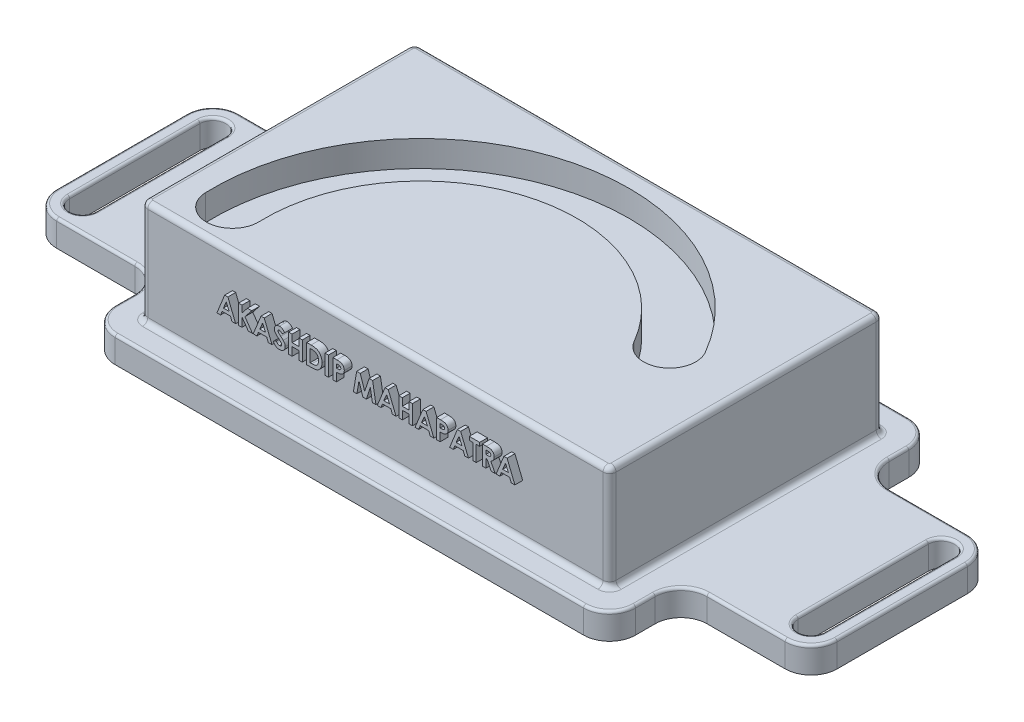
from build123d import *

# Parameters (mm, degrees)
SKETCH1_W           = 50
SKETCH1_H           = 70
BOSS_EXTRUDE1_DEPTH = 10
FILLET1_R           = 10
BOSS_EXTRUDE2_DEPTH = 40
FILLET2_R           = 2
CUT_EXTRUDE1_DEPTH  = 10
FILLET3_R           = 1
WRAP1_OUTLINE_W     = 1.329700854
WRAP1_OUTLINE_H     = 7.408333333
WRAP1_DEPTH         = 3


# Read off the part's stored shape, not the designer's step: Wrap1
with BuildPart() as part:
    # Sketch1 → Boss-Extrude1 (new body)
    # profile 1 of 5: a face of its own
    with BuildSketch(Plane(origin=(0, 0, 0), x_dir=(1, 0, 0), z_dir=(0, 1, 0))):
        with BuildLine():
            Line((140, 35), (100, 35))
            Line((100, 35), (100, -35))
            Line((100, -35), (140, -35))
            ThreePointArc((140, -35), (147.071067812, -32.071067812), (150, -25))
            Line((150, -25), (150, 25))
            ThreePointArc((150, 25), (147.071067812, 32.071067812), (140, 35))
        make_face()
        with BuildLine():
            Line((135, -25), (135, 25))
            ThreePointArc((135, 25), (140, 30), (145, 25))
            Line((145, 25), (145, -25))
            ThreePointArc((145, -25), (140, -30), (135, -25))
        make_face(mode=Mode.SUBTRACT)
    # profile 2 of 5: a face of its own
    with BuildSketch(Plane(origin=(0, 0, 0), x_dir=(1, 0, 0), z_dir=(0, 1, 0))):
        with Locations((75, 0)):
            Rectangle(SKETCH1_W, SKETCH1_H)
    # profile 3 of 5: a face of its own
    with BuildSketch(Plane(origin=(0, 0, 0), x_dir=(1, 0, 0), z_dir=(0, 1, 0))):
        with BuildLine():
            Line((90, 62.5), (-90, 62.5))
            ThreePointArc((-90, 62.5), (-97.071067812, 59.571067812), (-100, 52.5))
            Line((-100, 52.5), (-100, 35))
            Line((-100, 35), (-50, 35))
            Line((-50, 35), (-50, -35))
            Line((-50, -35), (-100, -35))
            Line((-100, -35), (-100, -52.5))
            ThreePointArc((-100, -52.5), (-97.071067812, -59.571067812), (-90, -62.5))
            Line((-90, -62.5), (90, -62.5))
            ThreePointArc((90, -62.5), (97.071067812, -59.571067812), (100, -52.5))
            Line((100, -52.5), (100, -35))
            Line((100, -35), (50, -35))
            Line((50, -35), (50, 35))
            Line((50, 35), (100, 35))
            Line((100, 35), (100, 52.5))
            ThreePointArc((100, 52.5), (97.071067812, 59.571067812), (90, 62.5))
        make_face()
    # profile 4 of 5: a face of its own
    with BuildSketch(Plane(origin=(0, 0, 0), x_dir=(1, 0, 0), z_dir=(0, 1, 0))):
        with Locations((-75, 0)):
            Rectangle(SKETCH1_W, SKETCH1_H)
    # profile 5 of 5: a face of its own
    with BuildSketch(Plane(origin=(0, 0, 0), x_dir=(1, 0, 0), z_dir=(0, 1, 0))):
        with BuildLine():
            Line((-100, -35), (-100, 35))
            Line((-100, 35), (-140, 35))
            ThreePointArc((-140, 35), (-147.071067812, 32.071067812), (-150, 25))
            Line((-150, 25), (-150, -25))
            ThreePointArc((-150, -25), (-147.071067812, -32.071067812), (-140, -35))
            Line((-140, -35), (-100, -35))
        make_face()
        with BuildLine():
            ThreePointArc((-145, 25), (-140, 30), (-135, 25))
            Line((-135, 25), (-135, -25))
            ThreePointArc((-135, -25), (-140, -30), (-145, -25))
            Line((-145, -25), (-145, 25))
        make_face(mode=Mode.SUBTRACT)
    extrude(amount=BOSS_EXTRUDE1_DEPTH)

    # Fillet1
    fillet1_edges = [part.edges().sort_by_distance(p)[0] for p in [
        (100, 5, -35),
        (100, 5, 35),
        (-100, 5, 35),
        (-100, 5, -35),
    ]]
    fillet(fillet1_edges, radius=FILLET1_R)

    # Sketch2 → Boss-Extrude2 (add)
    with BuildSketch(Plane(origin=(0, 10, 0), x_dir=(1, 0, 0), z_dir=(0, 1, 0))):
        with BuildLine():
            Line((-87.5, 52.5), (87.5, 52.5))
            ThreePointArc((87.5, 52.5), (89.267766953, 51.767766953), (90, 50))
            Line((90, 50), (90, -50))
            ThreePointArc((90, -50), (89.267766953, -51.767766953), (87.5, -52.5))
            Line((87.5, -52.5), (-87.5, -52.5))
            ThreePointArc((-87.5, -52.5), (-89.267766953, -51.767766953), (-90, -50))
            Line((-90, -50), (-90, 50))
            ThreePointArc((-90, 50), (-89.267766953, 51.767766953), (-87.5, 52.5))
        make_face()
    extrude(amount=BOSS_EXTRUDE2_DEPTH)

    # Fillet2
    fillet2_edges = [part.edges().sort_by_distance(p)[0] for p in [
        (89.267766953, 10, -51.767766953),
        (0, 10, -52.5),
        (-89.267766953, 10, -51.767766953),
        (-90, 10, 0),
        (-89.267766953, 10, 51.767766953),
        (0, 10, 52.5),
        (89.267766953, 10, 51.767766953),
        (90, 10, 0),
        (89.267766953, 50, -51.767766953),
        (0, 50, -52.5),
        (-89.267766953, 50, -51.767766953),
        (-90, 50, 0),
        (-89.267766953, 50, 51.767766953),
        (0, 50, 52.5),
        (89.267766953, 50, 51.767766953),
        (90, 50, 0),
    ]]
    fillet(fillet2_edges, radius=FILLET2_R)

    # Sketch3 → Cut-Extrude1 (cut)
    with BuildSketch(Plane(origin=(0, 50, 0), x_dir=(1, 0, 0), z_dir=(0, 1, 0))):
        with BuildLine():
            ThreePointArc((69.282032303, 5), (-22.082335197, 41.891940229), (-79.948963312, -37.857142857))
            ThreePointArc((-79.948963312, -37.857142857), (-69.598200041, -47.493620414), (-59.961722484, -37.142857143))
            ThreePointArc((-59.961722484, -37.142857143), (-16.561751398, 22.668955172), (51.961524227, -5))
            ThreePointArc((51.961524227, -5), (65.621778265, -8.660254038), (69.282032303, 5))
        make_face()
    extrude(amount=-CUT_EXTRUDE1_DEPTH, mode=Mode.SUBTRACT)

    # Fillet3
    fillet3_edges = [part.edges().sort_by_distance(p)[0] for p in [
        (145, 10, 0),
        (140, 10, 30),
        (135, 10, 0),
        (140, 10, -30),
        (-140, 10, 30),
        (-145, 10, 0),
        (-140, 10, -30),
        (-135, 10, 0),
        (-147.071067812, 10, -32.071067812),
        (-150, 10, 0),
        (-147.071067812, 10, 32.071067812),
        (-97.071067812, 10, 59.571067812),
        (0, 10, 62.5),
        (97.071067812, 10, 59.571067812),
        (147.071067812, 10, 32.071067812),
        (-100, 10, -48.75),
        (150, 10, 0),
        (147.071067812, 10, -32.071067812),
        (-125, 10, -35),
        (100, 10, -48.75),
        (-100, 10, 48.75),
        (-125, 10, 35),
        (97.071067812, 10, -59.571067812),
        (125, 10, -35),
        (125, 10, 35),
        (100, 10, 48.75),
        (-102.928932188, 10, -37.928932188),
        (0, 10, -62.5),
        (-102.928932188, 10, 37.928932188),
        (102.928932188, 10, -37.928932188),
        (102.928932188, 10, 37.928932188),
        (-97.071067812, 10, -59.571067812),
    ]]
    fillet(fillet3_edges, radius=FILLET3_R)

    # Wrap1 outline → Wrap1 (add)
    # profile 1 of 17: a face of its own
    with BuildSketch(Plane.XY.offset(52.5)):
        with BuildLine():
            add(Edge.make_bspline(
                [(-32.85559952, 35.308802516), (-32.898191392, 35.36888278), (-32.979961848, 35.484228508), (-33.112503227, 35.638679156), (-33.244446113, 35.770437053), (-33.377012878, 35.878951776), (-33.511378543, 35.963564016), (-33.647309868, 36.023470416), (-33.784036222, 36.061553483), (-33.875895225, 36.066295741), (-33.921141053, 36.068631576)],
                knots=[0, 0, 0, 0, 0.162420307, 0.31182434, 0.448432767, 0.573381197, 0.689077147, 0.797572901, 0.900293043, 1, 1, 1, 1], degree=3))
            Line((-32.85559952, 35.308802516), (-31.861291961, 36.21851973))
            add(Edge.make_bspline(
                [(-33.906300642, 37.39833243), (-33.81901379, 37.395139291), (-33.645129099, 37.388778219), (-33.388035568, 37.339036711), (-33.136917356, 37.26081295), (-32.934561594, 37.166444588), (-32.773550892, 37.075029912), (-32.650151229, 36.990866793), (-32.52458543, 36.894453417), (-32.395840884, 36.785485959), (-32.266309865, 36.66191133), (-32.132309186, 36.526671322), (-31.99566477, 36.378597143), (-31.906867565, 36.272813637), (-31.861291961, 36.21851973)],
                knots=[0, 0, 0, 0, 0.10691022, 0.212976528, 0.319776676, 0.428556273, 0.485856803, 0.546558687, 0.611431498, 0.67982091, 0.753158505, 0.830752869, 0.913133075, 1, 1, 1, 1], degree=3))
            add(Edge.make_bspline(
                [(-35.850394525, 35.519536357), (-35.848787564, 35.582962532), (-35.845621677, 35.707918912), (-35.817381475, 35.891649061), (-35.775175419, 36.068933217), (-35.713880108, 36.239124567), (-35.634326195, 36.402009939), (-35.537711058, 36.558386726), (-35.422534447, 36.706815671), (-35.292738182, 36.847198377), (-35.14973593, 36.975492194), (-34.99691985, 37.088724343), (-34.835154895, 37.184361862), (-34.665430662, 37.263700129), (-34.48669544, 37.324428532), (-34.300265962, 37.367475851), (-34.105874831, 37.393079024), (-33.97365418, 37.396559478), (-33.906300642, 37.39833243)],
                knots=[0, 0, 0, 0, 0.06317288, 0.12445736, 0.184840915, 0.244566821, 0.304319173, 0.365199786, 0.427420983, 0.491261689, 0.555499002, 0.618604518, 0.680494764, 0.742473305, 0.804990665, 0.868251971, 0.932887217, 1, 1, 1, 1], degree=3))
            add(Edge.make_bspline(
                [(-33.983470781, 32.919496292), (-34.077766347, 32.999279384), (-34.25874808, 33.152407284), (-34.514498229, 33.378572373), (-34.744952014, 33.589944372), (-34.948118987, 33.7891363), (-35.12658781, 33.972469546), (-35.279149814, 34.14143321), (-35.404129037, 34.297330618), (-35.53564272, 34.481980665), (-35.660607013, 34.706989435), (-35.768611624, 34.97770107), (-35.838680457, 35.248378355), (-35.846530696, 35.430096176), (-35.850394525, 35.519536357)],
                knots=[0, 0, 0, 0, 0.112124581, 0.215201009, 0.309902452, 0.395959096, 0.473447494, 0.542140328, 0.602523333, 0.654726333, 0.747804055, 0.835278417, 0.918925243, 1, 1, 1, 1], degree=3))
            add(Edge.make_bspline(
                [(-33.001035551, 31.641736877), (-33.003474883, 31.684010443), (-33.008430152, 31.769885145), (-33.044929139, 31.897567017), (-33.101988188, 32.025190823), (-33.169493067, 32.129871321), (-33.238187734, 32.217517464), (-33.30387533, 32.293458882), (-33.383865445, 32.377360855), (-33.47795526, 32.469328924), (-33.584901602, 32.570172707), (-33.704794561, 32.67988233), (-33.839007038, 32.797491382), (-33.933868681, 32.877605506), (-33.983470781, 32.919496292)],
                knots=[0, 0, 0, 0, 0.076346606, 0.155090822, 0.238351561, 0.32840414, 0.37938386, 0.439617644, 0.509831416, 0.588874645, 0.677436354, 0.77554672, 0.882635872, 1, 1, 1, 1], degree=3))
            add(Edge.make_bspline(
                [(-33.846938996, 30.939785422), (-33.78928309, 30.942117175), (-33.677422234, 30.946641115), (-33.517755177, 30.98842739), (-33.371366373, 31.054034907), (-33.244828973, 31.147647786), (-33.13768508, 31.255691277), (-33.058606737, 31.375894601), (-33.008929188, 31.505951696), (-33.003677067, 31.596297909), (-33.001035551, 31.641736877)],
                knots=[0, 0, 0, 0, 0.141985893, 0.275473311, 0.404345843, 0.535429711, 0.661427401, 0.77786684, 0.888279749, 1, 1, 1, 1], degree=3))
            add(Edge.make_bspline(
                [(-35.060884643, 31.889571747), (-35.01770716, 31.814518951), (-34.934932236, 31.670636327), (-34.794662389, 31.477311785), (-34.650963091, 31.311761316), (-34.500512144, 31.176911036), (-34.345138975, 31.070957821), (-34.184093096, 30.995236304), (-34.017261358, 30.94836477), (-33.903623157, 30.942640673), (-33.846938996, 30.939785422)],
                knots=[0, 0, 0, 0, 0.160457921, 0.307611547, 0.442138888, 0.566229194, 0.681222208, 0.789558005, 0.895028892, 1, 1, 1, 1], degree=3))
            Line((-35.060884643, 31.889571747), (-36.230309055, 31.187620291))
            add(Edge.make_bspline(
                [(-33.895912354, 29.610084567), (-33.959273199, 29.611208631), (-34.084764011, 29.613434921), (-34.269718496, 29.631610731), (-34.448312959, 29.660944554), (-34.620346229, 29.702988685), (-34.786593347, 29.756264302), (-34.947061141, 29.821338426), (-35.100641847, 29.899219684), (-35.248497531, 29.988306526), (-35.389909431, 30.091748084), (-35.526665644, 30.20742953), (-35.65740778, 30.337130096), (-35.782763765, 30.480543045), (-35.901931537, 30.638074488), (-36.018811884, 30.807530508), (-36.128210293, 30.99205598), (-36.195790557, 31.121502091), (-36.230309055, 31.187620291)],
                knots=[0, 0, 0, 0, 0.063551482, 0.125868382, 0.18624025, 0.244976651, 0.303357688, 0.361230317, 0.418489049, 0.475936712, 0.534203744, 0.594059429, 0.655468694, 0.718771685, 0.784974607, 0.853522316, 0.925182451, 1, 1, 1, 1], degree=3))
            add(Edge.make_bspline(
                [(-31.671334696, 31.718907016), (-31.672660799, 31.644086191), (-31.675262662, 31.497284947), (-31.707130492, 31.282463193), (-31.752572147, 31.076869451), (-31.822832917, 30.882740872), (-31.908466328, 30.696890894), (-32.015820176, 30.522214469), (-32.141892551, 30.3569438), (-32.28639085, 30.204033302), (-32.446223127, 30.065277624), (-32.617658434, 29.941754041), (-32.802373152, 29.839769591), (-32.998789108, 29.75579267), (-33.206801164, 29.691112522), (-33.426161516, 29.643307865), (-33.65720569, 29.614616264), (-33.815197025, 29.611616897), (-33.895912354, 29.610084567)],
                knots=[0, 0, 0, 0, 0.065200875, 0.127926544, 0.18904691, 0.248543693, 0.307607127, 0.36724766, 0.426963056, 0.488617128, 0.550391855, 0.611330734, 0.672556085, 0.734024191, 0.797340621, 0.862249627, 0.929625466, 1, 1, 1, 1], degree=3))
            add(Edge.make_bspline(
                [(-32.437099921, 33.418134113), (-32.3716958, 33.347352847), (-32.245966112, 33.211286397), (-32.082561839, 33.000426191), (-31.948074838, 32.794583635), (-31.844033143, 32.589885467), (-31.76545667, 32.383378299), (-31.710059216, 32.169997556), (-31.676881312, 31.947513542), (-31.67319779, 31.795695362), (-31.671334696, 31.718907016)],
                knots=[0, 0, 0, 0, 0.150833097, 0.289954183, 0.417138648, 0.535255184, 0.648751095, 0.762405462, 0.879826701, 1, 1, 1, 1], degree=3))
            add(Edge.make_bspline(
                [(-33.391338369, 34.272941805), (-33.329020209, 34.219008581), (-33.210753288, 34.116654526), (-33.042482945, 33.97137938), (-32.894601339, 33.840678873), (-32.764954172, 33.72651454), (-32.655506768, 33.627688536), (-32.565799011, 33.543728475), (-32.494735272, 33.476268904), (-32.454339698, 33.435523281), (-32.437099921, 33.418134113)],
                knots=[0, 0, 0, 0, 0.192952702, 0.366184141, 0.520457298, 0.655012135, 0.770624226, 0.865677185, 0.942674527, 1, 1, 1, 1], degree=3))
            add(Edge.make_bspline(
                [(-34.397518257, 35.228664295), (-34.380480757, 35.207155254), (-34.341262682, 35.157644282), (-34.266481845, 35.07922662), (-34.172572819, 34.983158121), (-34.055921788, 34.872742297), (-33.921371255, 34.744008166), (-33.762684631, 34.602016313), (-33.584429609, 34.442369417), (-33.457730068, 34.3311971), (-33.391338369, 34.272941805)],
                knots=[0, 0, 0, 0, 0.059234189, 0.136349281, 0.233805212, 0.349411224, 0.48317915, 0.635966856, 0.809243356, 1, 1, 1, 1], degree=3))
            add(Edge.make_bspline(
                [(-34.520693671, 35.583350125), (-34.519384942, 35.552514552), (-34.516749344, 35.490415991), (-34.491293053, 35.399402818), (-34.452923155, 35.310472353), (-34.416259151, 35.256336147), (-34.397518257, 35.228664295)],
                knots=[0, 0, 0, 0, 0.241881375, 0.487115475, 0.73783784, 1, 1, 1, 1], degree=3))
            add(Edge.make_bspline(
                [(-33.921141053, 36.068631576), (-33.963345064, 36.067151484), (-34.04482992, 36.064293816), (-34.160992627, 36.035888808), (-34.264123533, 35.986865935), (-34.354121986, 35.922764405), (-34.425414039, 35.845536922), (-34.482335215, 35.764545149), (-34.51438662, 35.675148549), (-34.518605216, 35.613747357), (-34.520693671, 35.583350125)],
                knots=[0, 0, 0, 0, 0.148126258, 0.285992887, 0.416634394, 0.547379946, 0.671582838, 0.784400739, 0.893265576, 1, 1, 1, 1], degree=3))
        make_face()
    # profile 2 of 17: a face of its own
    with BuildSketch(Plane.XY.offset(52.5)):
        with BuildLine():
            add(Edge.make_bspline(
                [(-21.732711232, 37.208375165), (-21.602088105, 37.207462065), (-21.349592122, 37.205697032), (-20.983775396, 37.185809351), (-20.643612392, 37.155223509), (-20.328883833, 37.113147141), (-20.040234965, 37.057468584), (-19.778037995, 36.987630747), (-19.541412926, 36.907014582), (-19.327765213, 36.812153306), (-19.132725401, 36.701554479), (-18.947528875, 36.578356265), (-18.772539263, 36.438045553), (-18.605300864, 36.283329217), (-18.447971924, 36.111376768), (-18.297932353, 35.925036364), (-18.158855801, 35.721605809), (-18.026538283, 35.505962728), (-17.906874696, 35.277193245), (-17.802499643, 35.0372446), (-17.715064029, 34.78766095), (-17.644018064, 34.528176305), (-17.587386231, 34.259652075), (-17.547762079, 33.981546402), (-17.523266033, 33.694116767), (-17.520781114, 33.499311591), (-17.519518457, 33.400325619)],
                knots=[0, 0, 0, 0, 0.060148162, 0.116267077, 0.168653955, 0.217398969, 0.262433523, 0.303932701, 0.342259967, 0.377441339, 0.411406099, 0.445398351, 0.479766387, 0.514584482, 0.550213651, 0.587000908, 0.624662987, 0.663615456, 0.703456428, 0.743450162, 0.784013386, 0.825132536, 0.867264663, 0.910306473, 0.954424205, 1, 1, 1, 1], degree=3))
            Line((-21.732711232, 37.208375165), (-23.408193671, 37.208375165))
            Line((-23.408193671, 37.208375165), (-23.408193671, 29.800041832))
            Line((-23.408193671, 29.800041832), (-21.707482533, 29.800041832))
            add(Edge.make_bspline(
                [(-17.519518457, 33.400325619), (-17.522824775, 33.260649971), (-17.529333455, 32.98569028), (-17.584158939, 32.582190102), (-17.672830311, 32.195394936), (-17.797510313, 31.828330446), (-17.95208014, 31.484265393), (-18.136731107, 31.169267222), (-18.348755801, 30.885026682), (-18.585684121, 30.632959058), (-18.842219788, 30.41630352), (-19.108812077, 30.230753906), (-19.388058082, 30.084432552), (-19.634112838, 29.991642933), (-19.847473009, 29.933935818), (-20.03480093, 29.899830357), (-20.247586336, 29.868553593), (-20.487813264, 29.844383582), (-20.754427891, 29.822829872), (-21.048492947, 29.811118425), (-21.369056333, 29.801387951), (-21.591717914, 29.800502296), (-21.707482533, 29.800041832)],
                knots=[0, 0, 0, 0, 0.065772947, 0.129477895, 0.191430088, 0.252445668, 0.311786958, 0.36881755, 0.424091518, 0.478492106, 0.531393744, 0.58200397, 0.631201271, 0.679503008, 0.705561374, 0.735221723, 0.769132486, 0.80685832, 0.848929771, 0.895116661, 0.945469804, 1, 1, 1, 1], degree=3))
        make_face()
        with BuildLine():
            add(Edge.make_bspline(
                [(-21.383961566, 31.129742687), (-21.301323014, 31.129894115), (-21.142381567, 31.130185361), (-20.912906096, 31.144057685), (-20.70069947, 31.157981673), (-20.506345845, 31.184409867), (-20.328430776, 31.213849016), (-20.16939835, 31.254817622), (-20.025970217, 31.297851672), (-19.899898324, 31.352639352), (-19.784426742, 31.414306532), (-19.677513247, 31.486556782), (-19.574311791, 31.566787961), (-19.476751808, 31.65735978), (-19.384464058, 31.757072899), (-19.297994572, 31.866441096), (-19.216189213, 31.985130684), (-19.141147768, 32.113769205), (-19.072574495, 32.250998208), (-19.011742317, 32.395488428), (-18.961303465, 32.54844316), (-18.919381779, 32.708430561), (-18.889423981, 32.876843505), (-18.864639618, 33.05243458), (-18.851862556, 33.235899463), (-18.850108984, 33.360735101), (-18.849219312, 33.424070278)],
                knots=[0, 0, 0, 0, 0.062614648, 0.120428813, 0.174199486, 0.223724664, 0.26902845, 0.310765001, 0.348115258, 0.382378114, 0.414753161, 0.447195432, 0.480044579, 0.513738641, 0.547962504, 0.582917814, 0.619315101, 0.657123545, 0.695686576, 0.735513716, 0.7758232, 0.817652262, 0.860742584, 0.905386927, 0.951998197, 1, 1, 1, 1], degree=3))
            Line((-21.383961566, 31.129742687), (-22.078492816, 31.129742687))
            Line((-22.078492816, 31.129742687), (-22.078492816, 35.878674311))
            Line((-22.078492816, 35.878674311), (-21.570950749, 35.878674311))
            add(Edge.make_bspline(
                [(-19.548202685, 35.285057858), (-19.603304163, 35.333284987), (-19.715842692, 35.431783437), (-19.913423366, 35.549809769), (-20.131147037, 35.653507471), (-20.373994568, 35.735728183), (-20.639618946, 35.800751828), (-20.929602236, 35.845597046), (-21.242391513, 35.874414108), (-21.459084637, 35.877223819), (-21.570950749, 35.878674311)],
                knots=[0, 0, 0, 0, 0.101663476, 0.207636138, 0.318744567, 0.436679942, 0.563506646, 0.698681208, 0.844446556, 1, 1, 1, 1], degree=3))
            add(Edge.make_bspline(
                [(-18.849219312, 33.424070278), (-18.850991237, 33.521125449), (-18.854446353, 33.710375512), (-18.887766749, 33.986022361), (-18.942005996, 34.245585162), (-19.019400176, 34.48810061), (-19.116957939, 34.714250299), (-19.239074221, 34.922118263), (-19.380493607, 35.115196398), (-19.4923242, 35.228462226), (-19.548202685, 35.285057858)],
                knots=[0, 0, 0, 0, 0.142276686, 0.277428514, 0.406477152, 0.530595072, 0.650142922, 0.766850697, 0.883502093, 1, 1, 1, 1], degree=3))
        make_face(mode=Mode.SUBTRACT)
    # profile 3 of 17: a face of its own
    with BuildSketch(Plane.XY.offset(52.5)):
        with BuildLine():
            add(Edge.make_bspline(
                [(-11.856417495, 37.208375165), (-11.759452173, 37.207941128), (-11.572385741, 37.207103779), (-11.302620555, 37.196949806), (-11.053748963, 37.178753269), (-10.825828142, 37.156265227), (-10.618951808, 37.124737867), (-10.43286089, 37.088594217), (-10.267516768, 37.044560731), (-10.121054943, 36.992293595), (-9.989610186, 36.930672683), (-9.86522105, 36.865042013), (-9.750698746, 36.786714123), (-9.640262984, 36.704130861), (-9.540227569, 36.609403079), (-9.444351693, 36.508835049), (-9.35669596, 36.398438324), (-9.276854206, 36.279549228), (-9.204425432, 36.154364324), (-9.14114681, 36.022659816), (-9.089818736, 35.884227297), (-9.046760864, 35.739962268), (-9.012176361, 35.589871017), (-8.989155816, 35.433030468), (-8.973519103, 35.270535741), (-8.972139379, 35.159941728), (-8.971441534, 35.104004839)],
                knots=[0, 0, 0, 0, 0.070781161, 0.136551696, 0.197012482, 0.252922694, 0.303686532, 0.349719151, 0.391240471, 0.428478555, 0.463056565, 0.497150358, 0.531002334, 0.564226377, 0.59770067, 0.631421421, 0.665597347, 0.700451436, 0.735880684, 0.771092108, 0.806974845, 0.843534403, 0.880940196, 0.919294384, 0.95918024, 1, 1, 1, 1], degree=3))
            Line((-11.856417495, 37.208375165), (-13.340458628, 37.208375165))
            Line((-13.340458628, 37.208375165), (-13.340458628, 29.800041832))
            Line((-13.340458628, 29.800041832), (-12.010757773, 29.800041832))
            Line((-12.010757773, 29.800041832), (-12.010757773, 33.029315336))
            add(Edge.make_bspline(
                [(-10.501487941, 33.142102462), (-10.539465642, 33.132653549), (-10.621737572, 33.11218416), (-10.757875019, 33.091402592), (-10.914759132, 33.072295218), (-11.092897221, 33.055874743), (-11.292391987, 33.044712647), (-11.513050266, 33.035995546), (-11.754972058, 33.029657313), (-11.923194906, 33.029432405), (-12.010757773, 33.029315336)],
                knots=[0, 0, 0, 0, 0.077372749, 0.167614291, 0.272108317, 0.390015992, 0.52136331, 0.667272254, 0.826809521, 1, 1, 1, 1], degree=3))
            add(Edge.make_bspline(
                [(-8.971441534, 35.104004839), (-8.972451228, 35.042123191), (-8.974435401, 34.920518149), (-8.993886692, 34.742260075), (-9.027115643, 34.572307141), (-9.070544143, 34.409226104), (-9.131102099, 34.255700007), (-9.200286719, 34.108065671), (-9.285405747, 33.970462309), (-9.382667843, 33.84116867), (-9.488889149, 33.719133535), (-9.606591353, 33.607880437), (-9.733531, 33.506650968), (-9.868973283, 33.414384236), (-10.013426693, 33.331266363), (-10.166786998, 33.256519038), (-10.330101431, 33.192532913), (-10.443828688, 33.159068687), (-10.501487941, 33.142102462)],
                knots=[0, 0, 0, 0, 0.068875425, 0.135348675, 0.199289315, 0.26155008, 0.322915384, 0.382771997, 0.442843572, 0.502652029, 0.562748843, 0.622739582, 0.682687332, 0.743329247, 0.805012514, 0.86806712, 0.933110571, 1, 1, 1, 1], degree=3))
        make_face()
        with BuildLine():
            add(Edge.make_bspline(
                [(-11.540316734, 34.359016191), (-11.45471256, 34.359558988), (-11.297199608, 34.360557742), (-11.082092538, 34.375000311), (-10.909228359, 34.397057031), (-10.772662447, 34.428691468), (-10.664830725, 34.476700915), (-10.571832615, 34.532238805), (-10.492065763, 34.602464942), (-10.422999409, 34.68271032), (-10.36778294, 34.774916281), (-10.329493195, 34.87758143), (-10.30462093, 34.988548662), (-10.302323745, 35.065774511), (-10.301142389, 35.105488881)],
                knots=[0, 0, 0, 0, 0.155159592, 0.285495954, 0.390502806, 0.470975045, 0.538445527, 0.60365534, 0.666587169, 0.73019895, 0.794944675, 0.860228437, 0.928120706, 1, 1, 1, 1], degree=3))
            Line((-11.540316734, 34.359016191), (-12.010757773, 34.359016191))
            Line((-12.010757773, 34.359016191), (-12.010757773, 35.878674311))
            Line((-12.010757773, 35.878674311), (-11.592258174, 35.878674311))
            add(Edge.make_bspline(
                [(-10.649892055, 35.731754239), (-10.673409901, 35.743647888), (-10.723202001, 35.76882918), (-10.808002774, 35.798104274), (-10.905861571, 35.822801041), (-11.01743905, 35.843299119), (-11.142290096, 35.859207756), (-11.280392432, 35.871373884), (-11.431949291, 35.876266357), (-11.537348018, 35.877849521), (-11.592258174, 35.878674311)],
                knots=[0, 0, 0, 0, 0.08210116, 0.173824981, 0.278953094, 0.396639095, 0.527315592, 0.671298143, 0.82875438, 1, 1, 1, 1], degree=3))
            add(Edge.make_bspline(
                [(-10.301142389, 35.105488881), (-10.302311593, 35.140186808), (-10.304580131, 35.207509129), (-10.321245426, 35.304671938), (-10.347805114, 35.395247719), (-10.38628908, 35.478290529), (-10.436039736, 35.553659265), (-10.496695853, 35.621324236), (-10.567479094, 35.682734545), (-10.622127895, 35.71523996), (-10.649892055, 35.731754239)],
                knots=[0, 0, 0, 0, 0.137787685, 0.267341238, 0.390444331, 0.511777883, 0.629508981, 0.747829066, 0.87188531, 1, 1, 1, 1], degree=3))
        make_face(mode=Mode.SUBTRACT)
    # profile 4 of 17: a face of its own
    with BuildSketch(Plane.XY.offset(52.5)):
        with BuildLine():
            add(Edge.make_bspline(
                [(28.034608146, 37.208375165), (28.131573468, 37.207941128), (28.3186399, 37.207103779), (28.588405086, 37.196949806), (28.837276678, 37.178753269), (29.065197499, 37.156265227), (29.272073833, 37.124737867), (29.458164752, 37.088594217), (29.623508873, 37.044560731), (29.769970698, 36.992293595), (29.901415455, 36.930672683), (30.025804591, 36.865042013), (30.140326895, 36.786714123), (30.250762657, 36.704130861), (30.350798072, 36.609403079), (30.446673948, 36.508835049), (30.534329681, 36.398438324), (30.614171435, 36.279549228), (30.686600209, 36.154364324), (30.749878831, 36.022659816), (30.801206905, 35.884227297), (30.844264777, 35.739962268), (30.87884928, 35.589871017), (30.901869826, 35.433030468), (30.917506538, 35.270535741), (30.918886262, 35.159941728), (30.919584107, 35.104004839)],
                knots=[0, 0, 0, 0, 0.070781161, 0.136551696, 0.197012482, 0.252922694, 0.303686532, 0.349719151, 0.391240471, 0.428478555, 0.463056565, 0.497150358, 0.531002334, 0.564226377, 0.59770067, 0.631421421, 0.665597347, 0.700451436, 0.735880684, 0.771092108, 0.806974845, 0.843534403, 0.880940196, 0.919294384, 0.95918024, 1, 1, 1, 1], degree=3))
            Line((28.034608146, 37.208375165), (26.550567013, 37.208375165))
            Line((26.550567013, 37.208375165), (26.550567013, 29.800041832))
            Line((26.550567013, 29.800041832), (27.880267868, 29.800041832))
            Line((27.880267868, 29.800041832), (27.880267868, 33.029315336))
            add(Edge.make_bspline(
                [(29.3895377, 33.142102462), (29.351559999, 33.132653549), (29.269288069, 33.11218416), (29.133150622, 33.091402592), (28.976266509, 33.072295218), (28.79812842, 33.055874743), (28.598633654, 33.044712647), (28.377975375, 33.035995546), (28.136053583, 33.029657313), (27.967830735, 33.029432405), (27.880267868, 33.029315336)],
                knots=[0, 0, 0, 0, 0.077372749, 0.167614291, 0.272108317, 0.390015992, 0.52136331, 0.667272254, 0.826809521, 1, 1, 1, 1], degree=3))
            add(Edge.make_bspline(
                [(30.919584107, 35.104004839), (30.918574413, 35.042123191), (30.91659024, 34.920518149), (30.897138949, 34.742260075), (30.863909998, 34.572307141), (30.820481498, 34.409226104), (30.759923542, 34.255700007), (30.690738922, 34.108065671), (30.605619894, 33.970462309), (30.508357798, 33.84116867), (30.402136492, 33.719133535), (30.284434288, 33.607880437), (30.157494641, 33.506650968), (30.022052358, 33.414384236), (29.877598948, 33.331266363), (29.724238643, 33.256519038), (29.56092421, 33.192532913), (29.447196953, 33.159068687), (29.3895377, 33.142102462)],
                knots=[0, 0, 0, 0, 0.068875425, 0.135348675, 0.199289315, 0.26155008, 0.322915384, 0.382771997, 0.442843572, 0.502652029, 0.562748843, 0.622739582, 0.682687332, 0.743329247, 0.805012514, 0.86806712, 0.933110571, 1, 1, 1, 1], degree=3))
        make_face()
        with BuildLine():
            add(Edge.make_bspline(
                [(28.350708907, 34.359016191), (28.436313081, 34.359558988), (28.593826033, 34.360557742), (28.808933103, 34.375000311), (28.981797283, 34.397057031), (29.118363194, 34.428691468), (29.226194916, 34.476700915), (29.319193026, 34.532238805), (29.398959878, 34.602464942), (29.468026232, 34.68271032), (29.523242701, 34.774916281), (29.561532446, 34.87758143), (29.586404711, 34.988548662), (29.588701896, 35.065774511), (29.589883252, 35.105488881)],
                knots=[0, 0, 0, 0, 0.155159592, 0.285495954, 0.390502806, 0.470975045, 0.538445527, 0.60365534, 0.666587169, 0.73019895, 0.794944675, 0.860228437, 0.928120706, 1, 1, 1, 1], degree=3))
            Line((28.350708907, 34.359016191), (27.880267868, 34.359016191))
            Line((27.880267868, 34.359016191), (27.880267868, 35.878674311))
            Line((27.880267868, 35.878674311), (28.298767467, 35.878674311))
            add(Edge.make_bspline(
                [(29.241133586, 35.731754239), (29.21761574, 35.743647888), (29.16782364, 35.76882918), (29.083022867, 35.798104274), (28.98516407, 35.822801041), (28.873586591, 35.843299119), (28.748735545, 35.859207756), (28.610633209, 35.871373884), (28.45907635, 35.876266357), (28.353677623, 35.877849521), (28.298767467, 35.878674311)],
                knots=[0, 0, 0, 0, 0.08210116, 0.173824981, 0.278953094, 0.396639095, 0.527315592, 0.671298143, 0.82875438, 1, 1, 1, 1], degree=3))
            add(Edge.make_bspline(
                [(29.589883252, 35.105488881), (29.588714048, 35.140186808), (29.58644551, 35.207509129), (29.569780215, 35.304671938), (29.543220527, 35.395247719), (29.504736561, 35.478290529), (29.454985905, 35.553659265), (29.394329788, 35.621324236), (29.323546547, 35.682734545), (29.268897746, 35.71523996), (29.241133586, 35.731754239)],
                knots=[0, 0, 0, 0, 0.137787685, 0.267341238, 0.390444331, 0.511777883, 0.629508981, 0.747829066, 0.87188531, 1, 1, 1, 1], degree=3))
        make_face(mode=Mode.SUBTRACT)
    # profile 5 of 17: a face of its own
    with BuildSketch(Plane.XY.offset(52.5)):
        with BuildLine():
            add(Edge.make_bspline(
                [(45.670952964, 37.208375165), (45.773363796, 37.208011666), (45.970328675, 37.207312553), (46.254341272, 37.196282413), (46.5152459, 37.180933069), (46.753428852, 37.157509561), (46.968788231, 37.126452821), (47.161539875, 37.089842063), (47.331678152, 37.048116256), (47.480637942, 36.996122609), (47.615066787, 36.937474563), (47.74037316, 36.870086882), (47.859321506, 36.79470995), (47.971116782, 36.709360396), (48.076730518, 36.615573638), (48.176361959, 36.513255268), (48.26860322, 36.401537671), (48.352883141, 36.281126759), (48.429697504, 36.154457241), (48.497585291, 36.021355199), (48.552791752, 35.881728069), (48.601572578, 35.737593765), (48.636707827, 35.586891858), (48.661143878, 35.431089458), (48.679034999, 35.269638123), (48.680063653, 35.159955255), (48.680588381, 35.104004839)],
                knots=[0, 0, 0, 0, 0.072889027, 0.14018613, 0.202277434, 0.258895132, 0.310482942, 0.357095244, 0.398513567, 0.435037511, 0.469251486, 0.502805028, 0.536210446, 0.56937936, 0.602801475, 0.636665798, 0.670928657, 0.705803, 0.741189061, 0.776304311, 0.812004301, 0.847968976, 0.884521761, 0.921974159, 0.960198176, 1, 1, 1, 1], degree=3))
            Line((45.670952964, 37.208375165), (44.121614022, 37.208375165))
            Line((44.121614022, 37.208375165), (44.121614022, 29.800041832))
            Line((44.121614022, 29.800041832), (45.451314876, 29.800041832))
            Line((45.451314876, 29.800041832), (45.451314876, 33.029315336))
            Line((45.451314876, 33.029315336), (45.902463381, 33.029315336))
            Line((45.902463381, 33.029315336), (47.534908626, 29.800041832))
            Line((47.534908626, 29.800041832), (49.013013594, 29.800041832))
            Line((49.013013594, 29.800041832), (47.30339821, 33.180687532))
            add(Edge.make_bspline(
                [(48.680588381, 35.104004839), (48.679225327, 35.045605459), (48.676552628, 34.931094917), (48.662156017, 34.762888271), (48.635843535, 34.601959917), (48.595989452, 34.448781034), (48.55018236, 34.301445133), (48.489270678, 34.162670653), (48.420525825, 34.030439319), (48.338879572, 33.906621595), (48.249276797, 33.788467242), (48.145070655, 33.68050319), (48.033012103, 33.576926781), (47.906801921, 33.484225691), (47.772003572, 33.396131805), (47.625938755, 33.316295284), (47.469560738, 33.242709222), (47.359619247, 33.201672551), (47.30339821, 33.180687532)],
                knots=[0, 0, 0, 0, 0.068741263, 0.134789088, 0.19853605, 0.260385651, 0.320961578, 0.37990385, 0.438502936, 0.496154344, 0.554265483, 0.612748761, 0.672513443, 0.733646402, 0.796789619, 0.861935699, 0.929397735, 1, 1, 1, 1], degree=3))
        make_face()
        with BuildLine():
            add(Edge.make_bspline(
                [(45.969245232, 34.359016191), (46.032566523, 34.359729358), (46.153813189, 34.361094919), (46.328181821, 34.367428959), (46.486550123, 34.382690866), (46.629598182, 34.401973715), (46.758045804, 34.424238548), (46.870747281, 34.456145406), (46.96943917, 34.490334412), (47.05295197, 34.532822478), (47.124303387, 34.581140625), (47.185910769, 34.63603124), (47.236868907, 34.699560138), (47.278810054, 34.770000877), (47.311435706, 34.847976488), (47.335249933, 34.932630976), (47.348558564, 35.024928664), (47.350089768, 35.088626636), (47.350887526, 35.121813333)],
                knots=[0, 0, 0, 0, 0.105539996, 0.202086415, 0.290684899, 0.37055261, 0.442670262, 0.507674928, 0.565573203, 0.616454666, 0.663331357, 0.708862024, 0.7534118, 0.798515011, 0.845064321, 0.893873119, 0.944707806, 1, 1, 1, 1], degree=3))
            Line((45.969245232, 34.359016191), (45.451314876, 34.359016191))
            Line((45.451314876, 34.359016191), (45.451314876, 35.878674311))
            Line((45.451314876, 35.878674311), (45.903947422, 35.878674311))
            add(Edge.make_bspline(
                [(47.350887526, 35.121813333), (47.349379291, 35.161075618), (47.346416643, 35.238199102), (47.317017968, 35.349229876), (47.270221629, 35.451996453), (47.206076666, 35.54603451), (47.125294423, 35.628474762), (47.032590426, 35.7011465), (46.925963899, 35.758609874), (46.827235759, 35.796512103), (46.737416228, 35.819189398), (46.656356936, 35.836088317), (46.562489787, 35.848065067), (46.455743917, 35.860768541), (46.336391425, 35.869006101), (46.203781769, 35.875017878), (46.058295802, 35.877477592), (45.956878265, 35.878263919), (45.903947422, 35.878674311)],
                knots=[0, 0, 0, 0, 0.06376896, 0.125262305, 0.185413583, 0.246806762, 0.309422389, 0.372532682, 0.437733251, 0.505749517, 0.544013263, 0.588369599, 0.640389019, 0.697897401, 0.763271619, 0.834978604, 0.913873656, 1, 1, 1, 1], degree=3))
        make_face(mode=Mode.SUBTRACT)
    # profile 6 of 17: a face of its own
    with BuildSketch(Plane.XY.offset(52.5)):
        Polygon((-52.134777872, 29.800041832), (-50.714550508, 29.800041832), (-53.706377431, 37.208375165), (-54.939615612, 37.208375165), (-57.932926577, 29.800041832), (-56.514183254, 29.800041832), (-55.938375295, 31.319699952), (-52.710585831, 31.319699952), align=None)
        Polygon((-54.323738542, 35.221244089), (-53.213675775, 32.649400806), (-55.43380131, 32.649400806), align=None, mode=Mode.SUBTRACT)
    # profile 7 of 17: a face of its own
    with BuildSketch(Plane.XY.offset(52.5)):
        Polygon((-48.29259538, 33.274182123), (-45.857283882, 29.800041832), (-44.2560035, 29.800041832), (-47.15285179, 33.931612345), (-44.512742616, 37.208375165), (-46.191193136, 37.208375165), (-48.29259538, 34.600914896), (-48.29259538, 37.208375165), (-49.622296235, 37.208375165), (-49.622296235, 29.800041832), (-48.29259538, 29.800041832), align=None)
    # profile 8 of 17: a face of its own
    with BuildSketch(Plane.XY.offset(52.5)):
        Polygon((-38.748726857, 31.319699952), (-38.172918898, 29.800041832), (-36.752691534, 29.800041832), (-39.744518457, 37.208375165), (-40.977756638, 37.208375165), (-43.971067602, 29.800041832), (-42.55232428, 29.800041832), (-41.97651632, 31.319699952), align=None)
        Polygon((-40.361879568, 35.221244089), (-39.251816801, 32.649400806), (-41.471942335, 32.649400806), align=None, mode=Mode.SUBTRACT)
    # profile 9 of 17: a face of its own
    with BuildSketch(Plane.XY.offset(52.5)):
        Polygon((-26.44750991, 33.029315336), (-26.44750991, 29.800041832), (-25.117809055, 29.800041832), (-25.117809055, 37.208375165), (-26.44750991, 37.208375165), (-26.44750991, 34.359016191), (-29.011932987, 34.359016191), (-29.011932987, 37.208375165), (-30.341633842, 37.208375165), (-30.341633842, 29.800041832), (-29.011932987, 29.800041832), (-29.011932987, 33.029315336), align=None)
    # profile 10 of 17: a face of its own
    with BuildSketch(Plane.XY.offset(52.5)):
        with Locations((-15.71492444, 33.504208498)):
            Rectangle(WRAP1_OUTLINE_W, WRAP1_OUTLINE_H)
    # profile 11 of 17: a face of its own
    with BuildSketch(Plane.XY.offset(52.5)):
        Polygon((1.048804193, 34.479223523), (1.839798116, 29.800041832), (3.185823423, 29.800041832), (1.933292708, 37.208375165), (0.566490825, 37.208375165), (-1.135704354, 32.040943942), (-2.826027204, 37.208375165), (-4.206185458, 37.208375165), (-5.457232132, 29.800041832), (-4.109722784, 29.800041832), (-3.320212901, 34.479223523), (-1.788682453, 29.800041832), (-0.491630503, 29.800041832), align=None)
    # profile 12 of 17: a face of its own
    with BuildSketch(Plane.XY.offset(52.5)):
        Polygon((8.930546647, 31.319699952), (9.506354607, 29.800041832), (10.92658197, 29.800041832), (7.934755047, 37.208375165), (6.701516866, 37.208375165), (3.708205902, 29.800041832), (5.126949225, 29.800041832), (5.702757184, 31.319699952), align=None)
        Polygon((7.317393936, 35.221244089), (8.427456703, 32.649400806), (6.207331169, 32.649400806), align=None, mode=Mode.SUBTRACT)
    # profile 13 of 17: a face of its own
    with BuildSketch(Plane.XY.offset(52.5)):
        Polygon((15.912960176, 33.029315336), (15.912960176, 29.800041832), (17.24266103, 29.800041832), (17.24266103, 37.208375165), (15.912960176, 37.208375165), (15.912960176, 34.359016191), (13.348537099, 34.359016191), (13.348537099, 37.208375165), (12.018836244, 37.208375165), (12.018836244, 29.800041832), (13.348537099, 29.800041832), (13.348537099, 33.029315336), align=None)
    # profile 14 of 17: a face of its own
    with BuildSketch(Plane.XY.offset(52.5)):
        Polygon((23.462277416, 31.319699952), (24.038085376, 29.800041832), (25.45831274, 29.800041832), (22.466485817, 37.208375165), (21.233247635, 37.208375165), (18.239936671, 29.800041832), (19.658679994, 29.800041832), (20.234487953, 31.319699952), align=None)
        Polygon((21.849124705, 35.221244089), (22.959187473, 32.649400806), (20.739061938, 32.649400806), align=None, mode=Mode.SUBTRACT)
    # profile 15 of 17: a face of its own
    with BuildSketch(Plane.XY.offset(52.5)):
        Polygon((36.759285963, 31.319699952), (37.335093923, 29.800041832), (38.755321287, 29.800041832), (35.763494364, 37.208375165), (34.530256182, 37.208375165), (31.536945218, 29.800041832), (32.955688541, 29.800041832), (33.5314965, 31.319699952), align=None)
        Polygon((35.146133252, 35.221244089), (36.25619602, 32.649400806), (34.036070485, 32.649400806), align=None, mode=Mode.SUBTRACT)
    # profile 16 of 17: a face of its own
    with BuildSketch(Plane.XY.offset(52.5)):
        Polygon((40.417447355, 35.878674311), (40.417447355, 29.800041832), (41.74714821, 29.800041832), (41.74714821, 35.878674311), (43.076849064, 35.878674311), (43.076849064, 37.208375165), (39.0877465, 37.208375165), (39.0877465, 35.878674311), align=None)
    # profile 17 of 17: a face of its own
    with BuildSketch(Plane.XY.offset(52.5)):
        Polygon((54.615268869, 31.319699952), (55.191076829, 29.800041832), (56.611304193, 29.800041832), (53.61947727, 37.208375165), (52.386239088, 37.208375165), (49.392928124, 29.800041832), (50.811671447, 29.800041832), (51.387479406, 31.319699952), align=None)
        Polygon((53.002116158, 35.221244089), (54.112178926, 32.649400806), (51.892053391, 32.649400806), align=None, mode=Mode.SUBTRACT)
    extrude(amount=WRAP1_DEPTH)


solid = part.part
